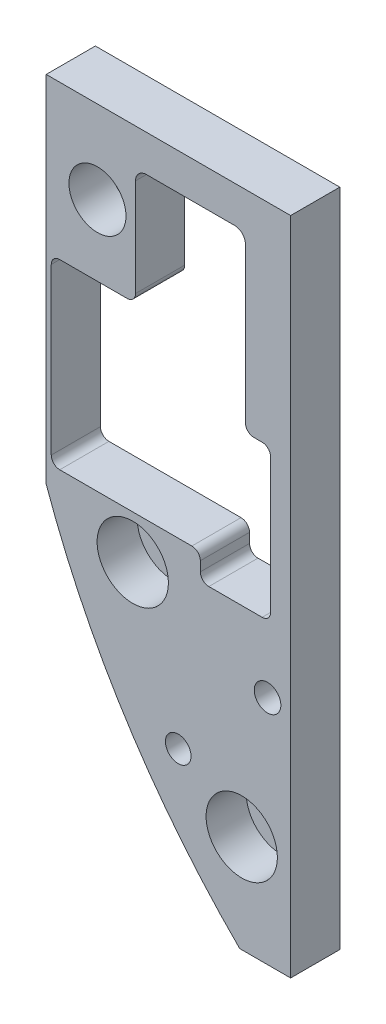
from build123d import *

# Parameters (mm, degrees)
SKETCH1_R           = 2.15265
SKETCH1_R_2         = 2.487009827
SKETCH1_R_3         = 2.39450721
BOSS_EXTRUDE1_DEPTH = 10.8
SKETCH3_R           = 6.6675
SKETCH3_R_2         = 5.334
CUT_EXTRUDE1_DEPTH  = 7.5
CUT_EXTRUDE2_DEPTH  = 1.6


with BuildPart() as part:
    # Sketch1 → Boss-Extrude1 (new body)
    with BuildSketch(Plane.XY):
        with BuildLine():
            Line((0, -17.78), (-45.72, -17.78))
            Line((-45.72, -17.78), (-45.72, -84.1375))
            ThreePointArc((-45.72, -84.1375), (-30.833523511, -114.746148224), (-9.525, -141.2875))
            Line((-9.525, -141.2875), (0, -141.2875))
            Line((0, -141.2875), (0, -17.78))
        make_face()
        with Locations((-36.1315, -33.274)):
            Circle(SKETCH1_R, mode=Mode.SUBTRACT)
        with Locations((-9.144, -122.9995)):
            Circle(SKETCH1_R, mode=Mode.SUBTRACT)
        with Locations((-4.3173518, -98.035919174)):
            Circle(SKETCH1_R_2, mode=Mode.SUBTRACT)
        with Locations((-21.024674116, -114.680376144)):
            Circle(SKETCH1_R_3, mode=Mode.SUBTRACT)
        with BuildLine():
            Line((-30.5943, -46.501483685), (-43.185677441, -46.501483685))
            ThreePointArc((-43.185677441, -46.501483685), (-44.308209457, -46.96645167), (-44.773177441, -48.088983685))
            Line((-44.773177441, -48.088983685), (-44.773177441, -78.965225138))
            ThreePointArc((-44.773177441, -78.965225138), (-44.308209457, -80.087757153), (-43.185677441, -80.552725138))
            Line((-43.185677441, -80.552725138), (-18.474223541, -80.552725138))
            ThreePointArc((-18.474223541, -80.552725138), (-17.351691526, -81.017693123), (-16.886723541, -82.140225138))
            Line((-16.886723541, -82.140225138), (-16.886723541, -83.937143103))
            ThreePointArc((-16.886723541, -83.937143103), (-16.421755557, -85.059675118), (-15.299223541, -85.524643103))
            Line((-15.299223541, -85.524643103), (-5.327492268, -85.524643103))
            ThreePointArc((-5.327492268, -85.524643103), (-4.204960252, -85.059675118), (-3.739992268, -83.937143103))
            Line((-3.739992268, -83.937143103), (-3.739992268, -58.7502))
            ThreePointArc((-3.739992268, -58.7502), (-4.204960252, -57.627667985), (-5.327492268, -57.1627))
            Line((-5.327492268, -57.1627), (-6.8707, -57.1627))
            ThreePointArc((-6.8707, -57.1627), (-7.993232015, -56.697732015), (-8.4582, -55.5752))
            Line((-8.4582, -55.5752), (-8.4582, -26.6573))
            ThreePointArc((-8.4582, -26.6573), (-9.053359021, -25.220459021), (-10.4902, -24.6253))
            Line((-10.4902, -24.6253), (-26.9748, -24.6253))
            ThreePointArc((-26.9748, -24.6253), (-28.411640979, -25.220459021), (-29.0068, -26.6573))
            Line((-29.0068, -26.6573), (-29.0068, -44.913983685))
            ThreePointArc((-29.0068, -44.913983685), (-29.471767985, -46.036515701), (-30.5943, -46.501483685))
        make_face(mode=Mode.SUBTRACT)
    extrude(amount=BOSS_EXTRUDE1_DEPTH)

    # Sketch3 → Cut-Extrude1 (cut)
    with BuildSketch(Plane.XY.offset(10.8)):
        with Locations((-9.144, -122.9995)):
            Circle(SKETCH3_R)
        with Locations((-29.5275, -88.7095)):
            Circle(SKETCH3_R)
        with Locations((-36.1315, -33.274)):
            Circle(SKETCH3_R_2)
    extrude(amount=-CUT_EXTRUDE1_DEPTH, mode=Mode.SUBTRACT)

    # Sketch4 → Cut-Extrude2 (cut)
    with BuildSketch(Plane(origin=(0, 0, 0), x_dir=(-1, 0, 0), z_dir=(0, 0, -1))):
        with BuildLine():
            Line((0, -17.78), (0, -141.2875))
            Line((0, -141.2875), (9.525, -141.2875))
            ThreePointArc((9.525, -141.2875), (30.833523511, -114.746148224), (45.72, -84.1375))
            Line((45.72, -84.1375), (45.72, -17.78))
            Line((45.72, -17.78), (0, -17.78))
        make_face()
    extrude(amount=-CUT_EXTRUDE2_DEPTH, mode=Mode.SUBTRACT)


solid = part.part
